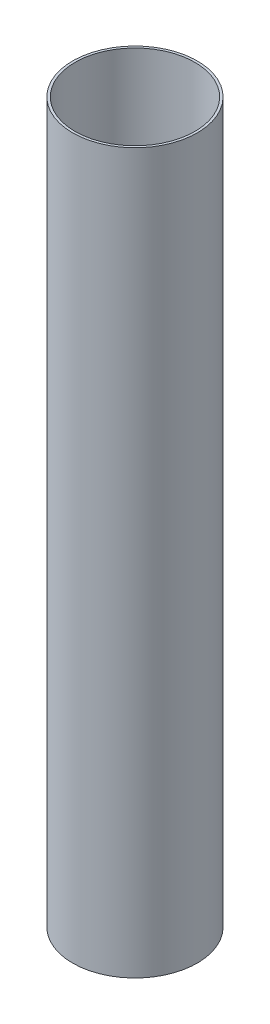
from build123d import *

# Parameters (mm, degrees)
SKETCH1_R           = 39.624
SKETCH1_R_2         = 38.1
BOSS_EXTRUDE1_DEPTH = 457.2


with BuildPart() as part:
    # Sketch1 → Boss-Extrude1 (new body)
    with BuildSketch(Plane(origin=(0, 0, 0), x_dir=(1, 0, 0), z_dir=(0, 1, 0))):
        Circle(SKETCH1_R)
        Circle(SKETCH1_R_2, mode=Mode.SUBTRACT)
    extrude(amount=BOSS_EXTRUDE1_DEPTH)


solid = part.part
